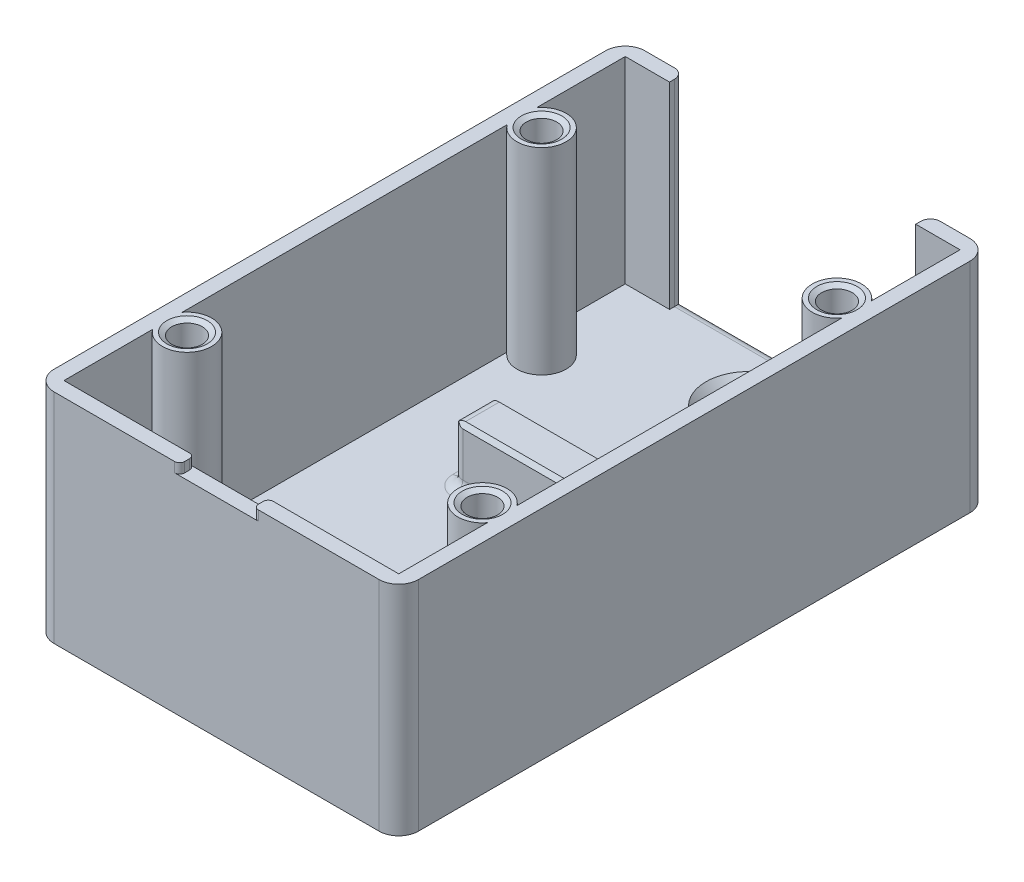
from build123d import *
from OCP.BRepFilletAPI import BRepFilletAPI_MakeChamfer

# Parameters (mm, degrees)
SKETCH_1_W          = 37
SKETCH_1_H          = 60
SKETCH_1_R          = 2.3
EXTRUDE_1_DEPTH     = 3
CHAMFER_1_SIZE      = 2
SKETCH_2_W          = 37
SKETCH_2_H          = 60
SKETCH_2_W_2        = 34
SKETCH_2_H_2        = 57
EXTRUDE_1_2_DEPTH   = 20
SKETCH_3_W          = 25
SKETCH_3_H          = 3.030341357
CUT_EXTRUDE_1_DEPTH = 20
SKETCH_4_R          = 2.5
EXTRUDE_2_DEPTH     = 20
SKETCH_5_R          = 1.55
CUT_EXTRUDE_2_DEPTH = 10
SKETCH_6_W          = 16
SKETCH_6_H          = 4
EXTRUDE_3_DEPTH     = 6
SKETCH_7_W          = 7.5
SKETCH_7_H          = 4.667229269
CUT_EXTRUDE_3_DEPTH = 1
FILLET_2_R          = 0.5
FILLET_3_R          = 2
CHAMFER_4_SIZE      = 0.866025404
CHAMFER_4_SIZE_2    = 1.5
FILLET_4_R          = 1
CHAMFER_5_SIZE      = 0.5
CHAMFER_5_SIZE_2    = 0.288675135
CHAMFER_6_SIZE      = 0.5
CHAMFER_6_SIZE2     = 0.288675135
FILLET_5_R          = 1


with BuildPart() as part:
    # Эскиз1 → Extrude 1 (new body)
    with BuildSketch(Plane(origin=(0, 0, 0), x_dir=(1, 0, 0), z_dir=(0, 1, 0))):
        Rectangle(SKETCH_1_W, SKETCH_1_H)
        with Locations(Location((0, 24, 0), (0, 0, 270))):
            Circle(SKETCH_1_R, mode=Mode.SUBTRACT)
        with Locations(Location((0, -24, 0), (0, 0, 270))):
            Circle(SKETCH_1_R, mode=Mode.SUBTRACT)
    extrude(amount=EXTRUDE_1_DEPTH)

    # Фаска1
    chamfer_1_edges = [part.edges().sort_by_distance(p)[0] for p in [
        (0, 3, -26.3),
        (0, 3, 21.7),
    ]]
    chamfer(chamfer_1_edges, length=CHAMFER_1_SIZE)

    # Эскиз2 → Extrude 1 2 (add)
    with BuildSketch(Plane(origin=(0, 3, 0), x_dir=(1, 0, 0), z_dir=(0, 1, 0))):
        Rectangle(SKETCH_2_W, SKETCH_2_H)
        Rectangle(SKETCH_2_W_2, SKETCH_2_H_2, mode=Mode.SUBTRACT)
    extrude(amount=EXTRUDE_1_2_DEPTH)

    # Эскиз3 → Вырез-Вытянуть1 (cut)
    with BuildSketch(Plane(origin=(0, 23, 0), x_dir=(1, 0, 0), z_dir=(0, 1, 0))):
        with Locations((0, 29.478101209)):
            Rectangle(SKETCH_3_W, SKETCH_3_H)
    extrude(amount=-CUT_EXTRUDE_1_DEPTH, mode=Mode.SUBTRACT)

    # Эскиз4 → Бобышка-Вытянуть2 (add)
    with BuildSketch(Plane(origin=(0, 3, 0), x_dir=(1, 0, 0), z_dir=(0, 1, 0))):
        with Locations((15, 18)):
            Circle(SKETCH_4_R)
        with Locations((-15, 18)):
            Circle(SKETCH_4_R)
        with Locations((15, -18)):
            Circle(SKETCH_4_R)
        with Locations((-15, -18)):
            Circle(SKETCH_4_R)
    extrude(amount=EXTRUDE_2_DEPTH)

    # Эскиз5 → Вырез-Вытянуть2 (cut)
    with BuildSketch(Plane(origin=(0, 23, 0), x_dir=(1, 0, 0), z_dir=(0, 1, 0))):
        with Locations(Location((15, 18, 0), (0, 0, 270))):
            Circle(SKETCH_5_R)
        with Locations(Location((15, -18, 0), (0, 0, 270))):
            Circle(SKETCH_5_R)
        with Locations(Location((-15, -18, 0), (0, 0, 270))):
            Circle(SKETCH_5_R)
        with Locations(Location((-15, 18, 0), (0, 0, 270))):
            Circle(SKETCH_5_R)
    extrude(amount=-CUT_EXTRUDE_2_DEPTH, mode=Mode.SUBTRACT)

    # Эскиз6 → Бобышка-Вытянуть3 (add)
    with BuildSketch(Plane(origin=(0, 3, 0), x_dir=(1, 0, 0), z_dir=(0, 1, 0))):
        with Locations((0, 4)):
            Rectangle(SKETCH_6_W, SKETCH_6_H)
    extrude(amount=EXTRUDE_3_DEPTH)

    # Эскиз7 → Вырез-Вытянуть3 (cut)
    with BuildSketch(Plane(origin=(0, 23, 0), x_dir=(1, 0, 0), z_dir=(0, 1, 0))):
        with Locations((0, -28.649225697)):
            Rectangle(SKETCH_7_W, SKETCH_7_H)
    extrude(amount=-CUT_EXTRUDE_3_DEPTH, mode=Mode.SUBTRACT)

    # Скругление2
    fillet_2_edges = [part.edges().sort_by_distance(p)[0] for p in [
        (-3.75, 22.5, 28.5),
        (3.75, 22.5, 28.5),
        (3.75, 22.5, 30),
        (-3.75, 22.5, 30),
    ]]
    fillet(fillet_2_edges, radius=FILLET_2_R)

    # Скругление3
    fillet_3_edges = [part.edges().sort_by_distance(p)[0] for p in [
        (18.5, 11.5, 30),
        (-18.5, 11.5, 30),
        (-18.5, 11.5, -30),
        (18.5, 11.5, -30),
    ]]
    fillet(fillet_3_edges, radius=FILLET_3_R)

    # Фаска4
    # the kernel refuses this chamfer: 1.5, 0.866025404 mm, written as the material it takes off along each edge
    with BuildSketch(Plane(origin=(0, 0, 24), x_dir=(0, 0, 1), z_dir=(-1, 0, 0))) as chamfer_4_piece_1:
        Polygon((2.3 + CHAMFER_4_SIZE, 0), (2.3, CHAMFER_4_SIZE_2), (2.3, 0), align=None)
    revolve(axis=Axis((0, 0, 24), (0, 1, 0)), mode=Mode.SUBTRACT)
    with BuildSketch(Plane(origin=(16.5, 0, -30), x_dir=(0, -0.01932676561270073, 0.999813220622208), z_dir=(-1, 0, 0))) as chamfer_4_piece_2:
        Polygon((CHAMFER_4_SIZE_2 * 0.999813220622, CHAMFER_4_SIZE_2 * 0.0193267656127), (-CHAMFER_4_SIZE * 0.0193267656079, CHAMFER_4_SIZE * 0.999813220373), (0, 0), align=None)
    extrude(amount=33, mode=Mode.SUBTRACT)
    with BuildSketch(Plane(origin=(-18.5, 0, -28), x_dir=(0.999813220622208, -0.01932676561270073, 0), z_dir=(0, 0, 1)), Plane(origin=(18.5, 0, 28), x_dir=(-0.999813220622208, -0.01932676561270073, 0), z_dir=(0, 0, -1))) as chamfer_4_piece_3:
        Polygon((CHAMFER_4_SIZE_2 * 0.999813220622, CHAMFER_4_SIZE_2 * 0.0193267656127), (-CHAMFER_4_SIZE * 0.0193267656079, CHAMFER_4_SIZE * 0.999813220373), (0, 0), align=None)
    extrude(amount=56, mode=Mode.SUBTRACT)
    with BuildSketch(Plane(origin=(-16.5, 0, 30), x_dir=(0, 0.9983227437537924, 0.0578938624026721), z_dir=(1, 0, 0))) as chamfer_4_piece_4:
        Polygon((CHAMFER_4_SIZE * 0.998322743505, -CHAMFER_4_SIZE * 0.0578938623883), (-CHAMFER_4_SIZE_2 * 0.0578938624027, -CHAMFER_4_SIZE_2 * 0.998322743754), (0, 0), align=None)
    extrude(amount=33, mode=Mode.SUBTRACT)
    with BuildSketch(Plane(origin=(-16.5, 0, -28), x_dir=(0, 0, -1), z_dir=(1, 0, 0))) as chamfer_4_piece_5:
        Polygon((2 - CHAMFER_4_SIZE_2, 0), (2, CHAMFER_4_SIZE), (2, 0), align=None)
    revolve(axis=Axis((-16.5, 0, -28), (0, 1, 0)), revolution_arc=90, mode=Mode.SUBTRACT)
    with BuildSketch(Plane(origin=(-16.5, 0, 28), x_dir=(0, 0, 1), z_dir=(1, 0, 0))) as chamfer_4_piece_6:
        Polygon((2 - CHAMFER_4_SIZE_2, 0), (2, -CHAMFER_4_SIZE), (2, 0), align=None)
    revolve(axis=Axis((-16.5, 0, 28), (0, -1, 0)), revolution_arc=90, mode=Mode.SUBTRACT)
    with BuildSketch(Plane(origin=(16.5, 0, 28), x_dir=(0, 0, 1), z_dir=(-1, 0, 0))) as chamfer_4_piece_7:
        Polygon((2, CHAMFER_4_SIZE), (2 - CHAMFER_4_SIZE_2, 0), (2, 0), align=None)
    revolve(axis=Axis((16.5, 0, 28), (0, 1, 0)), revolution_arc=90, mode=Mode.SUBTRACT)
    with BuildSketch(Plane(origin=(16.5, 0, -28), x_dir=(0, 0, -1), z_dir=(-1, 0, 0))) as chamfer_4_piece_8:
        Polygon((2 - CHAMFER_4_SIZE_2, 0), (2, -CHAMFER_4_SIZE), (2, 0), align=None)
    revolve(axis=Axis((16.5, 0, -28), (0, -1, 0)), revolution_arc=90, mode=Mode.SUBTRACT)
    with BuildSketch(Plane(origin=(0, 0, -24), x_dir=(0, 0, 1), z_dir=(-1, 0, 0))) as chamfer_4_piece_9:
        Polygon((2.3 + CHAMFER_4_SIZE, 0), (2.3, CHAMFER_4_SIZE_2), (2.3, 0), align=None)
    revolve(axis=Axis((0, 0, -24), (0, 1, 0)), mode=Mode.SUBTRACT)

    # Скругление4
    fillet_4_edges = [part.edges().sort_by_distance(p)[0] for p in [
        (-8, 3, -4),
        (-8, 6, -6),
        (0, 3, -2),
        (-8, 6, -2),
        (8, 3, -4),
        (8, 6, -2),
        (0, 3, -6),
        (8, 6, -6),
        (-8, 9, -4),
        (8, 9, -4),
    ]]
    fillet(fillet_4_edges, radius=FILLET_4_R)

    # Фаска5
    # the kernel refuses this chamfer: 0.5, 0.288675135 mm, written as the material it takes off along each edge
    with BuildSketch(Plane(origin=(-8.293542877, 9, -6), x_dir=(0, -0.9998132206222079, -0.019326765612700324), z_dir=(1, 0, 0)), Plane(origin=(8.293542877, 9, -2), x_dir=(0, -0.9998132206222079, 0.01932676561270075), z_dir=(-1, 0, 0))) as chamfer_5_piece_1:
        Polygon((CHAMFER_5_SIZE * 0.999813220622, -CHAMFER_5_SIZE * 0.0193267656127), (-CHAMFER_5_SIZE_2 * 0.0193267655856, -CHAMFER_5_SIZE_2 * 0.999813219219), (0, 0), align=None)
    extrude(amount=16.587085755, mode=Mode.SUBTRACT)

    # Фаска6: one chamfer whose edges measure the first distance from different faces: ONE call of the kernel's chamfer builder (chamfer() names one face for all edges)
    chamfer_6_edges_1 = [part.edges().sort_by_distance(p)[0] for p in [
        (-15, 23, -19.55),
        (-15, 23, 16.45),
    ]]
    chamfer_6_side_1 = [part.faces().sort_by_distance(p)[0] for p in [
        (-10.375, 23, 29.382135735),
    ]]
    chamfer_6_edges_2 = [part.edges().sort_by_distance(p)[0] for p in [
        (15, 23, 16.45),
        (15, 23, -19.55),
    ]]
    chamfer_6_side_2 = [part.faces().sort_by_distance(p)[0] for p in [
        (10.375, 23, 29.382135735),
    ]]
    chamfer_6 = BRepFilletAPI_MakeChamfer(part.part.solid().wrapped)
    for e in chamfer_6_edges_1:
        chamfer_6.Add(CHAMFER_6_SIZE, CHAMFER_6_SIZE2, e.wrapped, chamfer_6_side_1[0].wrapped)  # the first distance lies on this face
    for e in chamfer_6_edges_2:
        chamfer_6.Add(CHAMFER_6_SIZE, CHAMFER_6_SIZE2, e.wrapped, chamfer_6_side_2[0].wrapped)  # the first distance lies on this face
    add(Compound.cast(chamfer_6.Shape()), mode=Mode.REPLACE)

    # Скругление5
    fillet_5_edges = [part.edges().sort_by_distance(p)[0] for p in [
        (0, 3, -30),
        (-12.5, 13, -30),
        (12.5, 13, -30),
    ]]
    fillet(fillet_5_edges, radius=FILLET_5_R)


solid = part.part
